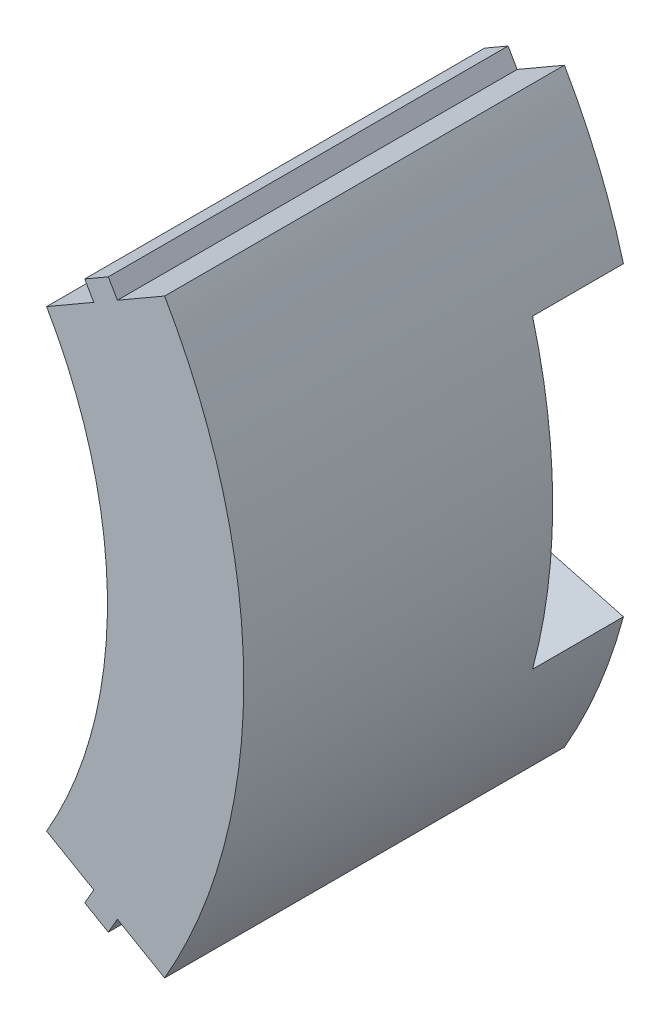
from build123d import *

# Parameters (mm, degrees)
EXTRUDE_1_DEPTH     = 22
SKETCH_4_W          = 1.5
SKETCH_4_H          = 22
EXTRUDE_2_DEPTH     = 1
SKETCH_2_W          = 1.5
SKETCH_2_H          = 22
EXTRUDE_3_DEPTH     = 1
CUT_EXTRUDE_2_DEPTH = 5


with BuildPart() as part:
    # Эскиз1 → Бобышка-Вытянуть1 (new body)
    with BuildSketch(Plane.XY):
        with BuildLine():
            Line((21.650635095, 12.5), (28.145825623, 16.25))
            ThreePointArc((28.145825623, 16.25), (32.5, 0), (28.145825623, -16.25))
            Line((28.145825623, -16.25), (21.650635095, -12.5))
            ThreePointArc((21.650635095, -12.5), (25, 0), (21.650635095, 12.5))
        make_face()
    extrude(amount=EXTRUDE_1_DEPTH)

    # Эскиз4 → Бобышка-Вытянуть2 (add)
    with BuildSketch(Plane(origin=(0, 0, 0), x_dir=(-0.866025403784438, -0.5000000000000012, 0), z_dir=(-0.5000000000000011, 0.8660254037844379, 0))):
        with Locations((-28.75, 11)):
            Rectangle(SKETCH_4_W, SKETCH_4_H)
    extrude(amount=EXTRUDE_2_DEPTH)

    # Эскиз2 → Бобышка-Вытянуть3 (add)
    with BuildSketch(Plane(origin=(0, 0, 0), x_dir=(0.866025403784438, -0.5000000000000012, 0), z_dir=(-0.5000000000000011, -0.8660254037844379, 0))):
        with Locations((28.75, 11)):
            Rectangle(SKETCH_2_W, SKETCH_2_H)
    extrude(amount=EXTRUDE_3_DEPTH)

    # Эскиз6 → Вырез-Вытянуть2 (cut)
    with BuildSketch(Plane(origin=(0, 0, 0), x_dir=(-1, 0, 0), z_dir=(0, 0, -1))):
        with BuildLine():
            Line((-24.148145657, 6.470476128), (-31.392589354, 8.411618966))
            ThreePointArc((-31.392589354, 8.411618966), (-32.5, 0), (-31.392589354, -8.411618966))
            Line((-31.392589354, -8.411618966), (-24.148145657, -6.470476128))
            ThreePointArc((-24.148145657, -6.470476128), (-25, 0), (-24.148145657, 6.470476128))
        make_face()
    extrude(amount=-CUT_EXTRUDE_2_DEPTH, mode=Mode.SUBTRACT)


solid = part.part
